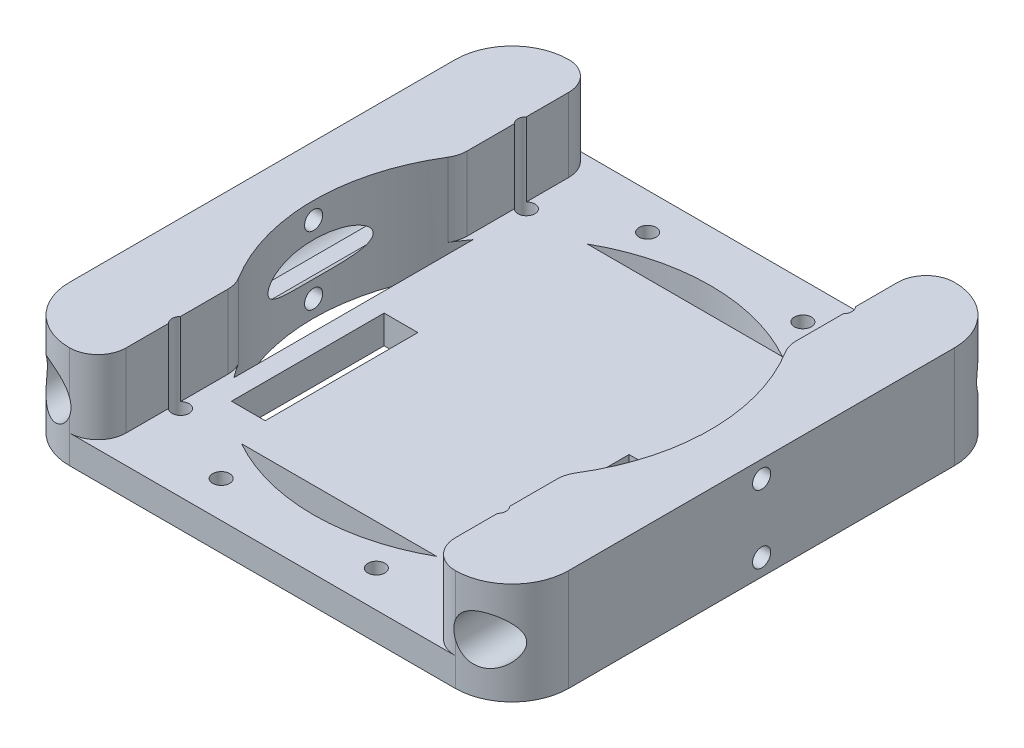
from build123d import *

# Parameters (mm, degrees)
BOSS_EXTRUDE1_DEPTH     = 18
SKETCH2_R               = 4.250000000000005
CUT_EXTRUDE1_DEPTH      = 101.0199980003999
FILLET1_R               = 10
SKETCH3_R               = 35.00000000000001
CUT_EXTRUDE2_DEPTH      = 65.77653912644608
BOSS_EXTRUDE2_START     = 5
SKETCH5_R               = 43.99999999999999
SKETCH5_R_2             = 35.00000000000001
BOSS_EXTRUDE2_DEPTH     = 5
SKETCH8_W               = 58
SKETCH8_H               = 92
CUT_EXTRUDE4_DEPTH      = 13
FILLET2_R               = 5
BOSS_EXTRUDE3_DEPTH     = 5
CUT_EXTRUDE5_DEPTH      = 64.56886046013409
CUT_EXTRUDE5_DEPTH_BACK = 64.56886046013409
SKETCH11_R              = 1.5000000000000009
CUT_EXTRUDE6_REACH      = 102.02
CUT_EXTRUDE6_END_RADIUS = 35.00000000000001
SKETCH12_R              = 1.6000000000000008
SKETCH12_R_2            = 1.6000000000000003
SKETCH13_R              = 1.5000000000000024
CUT_EXTRUDE7_DEPTH      = 64.56886046013409
MIRROR3_COPY_1_SKETCH_R = 1.5000000000000024
MIRROR3_COPY_1_DEPTH    = 64.56886046013409


with BuildPart() as part:
    # Sketch1 → Boss-Extrude1 (new body)
    with BuildSketch(Plane(origin=(0, 0, 0), x_dir=(1, 0, 0), z_dir=(0, 1, 0))):
        Polygon((-44, -44), (43.99999999999999, -44), (43.99999999999999, 44), (-43.99999999999999, 44), align=None)
    extrude(amount=BOSS_EXTRUDE1_DEPTH)

    # Sketch2 → Cut-Extrude1 (cut, through all)
    with BuildSketch(Plane.XY.offset(44)):
        with Locations((-38, 9)):
            Circle(SKETCH2_R)
        with Locations(Location((38, 9, 0), (0, 0, 180))):
            Circle(SKETCH2_R)
    extrude(amount=-CUT_EXTRUDE1_DEPTH, mode=Mode.SUBTRACT)

    # Fillet1
    # the kernel refuses this fillet: 10 mm, written as the material it takes off along each edge
    with BuildSketch(Plane(origin=(44, -25, 44), x_dir=(-1, 0, 0), z_dir=(0, 1, 0)), Plane(origin=(43.99999999999999, -25, -44), x_dir=(0, 0, 1), z_dir=(0, 1, 0))) as fillet1_piece_1:
        with BuildLine():
            CenterArc((FILLET1_R, -FILLET1_R), FILLET1_R, 90, 90)
            Line((0, -FILLET1_R), (0, 0))
            Line((0, 0), (FILLET1_R, 0))
        make_face()
    extrude(amount=68, mode=Mode.SUBTRACT)
    with BuildSketch(Plane(origin=(-44, -25, 44), x_dir=(1, 0, 0), z_dir=(0, 1, 0)), Plane(origin=(-43.99999999999999, -25, -44), x_dir=(0, 0, 1), z_dir=(0, 1, 0))) as fillet1_piece_2:
        with BuildLine():
            CenterArc((FILLET1_R, FILLET1_R), FILLET1_R, 180, 90)
            Line((0, FILLET1_R), (0, 0))
            Line((0, 0), (FILLET1_R, 0))
        make_face()
    extrude(amount=68, mode=Mode.SUBTRACT)

    # Sketch3 → Cut-Extrude2 (cut, through all)
    with BuildSketch(Plane(origin=(0, 18, 0), x_dir=(1, 0, 0), z_dir=(0, 1, 0))):
        with Locations(Location((0, 0, 0), (0, 0, 270))):
            Circle(SKETCH3_R)
    extrude(amount=-CUT_EXTRUDE2_DEPTH, mode=Mode.SUBTRACT)

    # Sketch5 → Boss-Extrude2 (add)
    with BuildSketch(Plane(origin=(0, 0, 0), x_dir=(1, 0, 0), z_dir=(0, 1, 0)).offset(BOSS_EXTRUDE2_START)):
        Circle(SKETCH5_R)
        with Locations(Location((0, 0, 0), (0, 0, 270))):
            Circle(SKETCH5_R_2, mode=Mode.SUBTRACT)
    extrude(amount=-BOSS_EXTRUDE2_DEPTH)

    # Sketch8 → Cut-Extrude4 (cut)
    with BuildSketch(Plane(origin=(0, 18, 0), x_dir=(1, 0, 0), z_dir=(0, 1, 0))):
        Rectangle(SKETCH8_W, SKETCH8_H)
    extrude(amount=-CUT_EXTRUDE4_DEPTH, mode=Mode.SUBTRACT)

    # Fillet2
    # the kernel refuses this fillet: 5 mm, written as the material it takes off along each edge
    with BuildSketch(Plane(origin=(29, 30.5, 44), x_dir=(1, 0, 0), z_dir=(0, -1, 0)), Plane(origin=(-29.000000000000007, 30.5, -44), x_dir=(-1, 0, 0), z_dir=(0, -1, 0))) as fillet2_piece_1:
        with BuildLine():
            CenterArc((FILLET2_R, -FILLET2_R), FILLET2_R, 90, 90)
            Line((0, -FILLET2_R), (0, 0))
            Line((0, 0), (FILLET2_R, 0))
        make_face()
    extrude(amount=25.5, mode=Mode.SUBTRACT)
    with BuildSketch(Plane(origin=(28.999999999999996, 5, 19.59591794226544), x_dir=(0.5434386589178635, 0, -0.8394488811080482), z_dir=(0, 1, 0))) as fillet2_piece_2:
        with BuildLine():
            CenterArc((1.4786791763610776, -4.999028131277516), FILLET2_R, 91.12970087647003, 31.78833061705157)
            Line((-1.2385141182282366, -0.8017837257372739), (0, 0))
            ThreePointArc((0, 0), (0.6900502823018299, -0.00680308105738167), (1.380100564603668, -4e-17))
        make_face()
    extrude(amount=16.688473908600116, mode=Mode.SUBTRACT)
    with BuildSketch(Plane(origin=(28.999999999999996, 5, -19.59591794226544), x_dir=(2.41e-15, 0, -1), z_dir=(0, 1, 0))) as fillet2_piece_3:
        with BuildLine():
            CenterArc((1.475389563440055, -5), FILLET2_R, 90.00000000000014, 31.788330617051614)
            ThreePointArc((-1.15852387477314, -0.7500000000000063), (-0.5755648801402335, -0.38071083878170736), (0, 0))
            Line((0, 0), (1.475389563440043, 0))
        make_face()
    extrude(amount=16.688473908600105, mode=Mode.SUBTRACT)
    with BuildSketch(Plane(origin=(28.999999999999996, 5, -44), x_dir=(1, 0, 0), z_dir=(0, 1, 0))) as fillet2_piece_4:
        with BuildLine():
            CenterArc((FILLET2_R, -FILLET2_R), FILLET2_R, 90, 89.99999999999991)
            Line((-3.55e-15, -FILLET2_R), (0, 0))
            Line((0, 0), (FILLET2_R, 0))
        make_face()
    extrude(amount=25.49999999999999, mode=Mode.SUBTRACT)
    with BuildSketch(Plane(origin=(-29.000000000000004, 5, -19.59591794226543), x_dir=(2.41e-15, 0, -1), z_dir=(0, 1, 0))) as fillet2_piece_5:
        with BuildLine():
            CenterArc((1.4753895634400487, 5), FILLET2_R, 238.21166938294837, 31.78833061705177)
            ThreePointArc((-1.1585238747731363, 0.7500000000000008), (-0.575564880140214, 0.3807108387816939), (0, 0))
            Line((0, 0), (1.4753895634400607, 0))
        make_face()
    extrude(amount=16.68847390860015, mode=Mode.SUBTRACT)
    with BuildSketch(Plane(origin=(-29.000000000000004, 5, 19.59591794226543), x_dir=(-0.5434386589178587, 0, -0.8394488811080513), z_dir=(0, 1, 0))) as fillet2_piece_6:
        with BuildLine():
            CenterArc((1.4786791763610454, 4.9990281312775195), FILLET2_R, 237.08196850647857, 31.78833061705177)
            Line((-1.238514118228257, 0.8017837257372686), (0, 0))
            ThreePointArc((0, 0), (0.6900502823018377, 0.00680308105738472), (1.380100564603667, -2e-17))
        make_face()
    extrude(amount=16.68847390860015, mode=Mode.SUBTRACT)
    with BuildSketch(Plane(origin=(-29.000000000000004, 5, 44), x_dir=(-1, 0, 0), z_dir=(0, 1, 0))) as fillet2_piece_7:
        with BuildLine():
            CenterArc((FILLET2_R, -FILLET2_R), FILLET2_R, 90, 90)
            Line((-3.55e-15, -FILLET2_R), (0, 0))
            Line((0, 0), (FILLET2_R, 0))
        make_face()
    extrude(amount=25.5, mode=Mode.SUBTRACT)

    # Sketch10 → Boss-Extrude3 (add)
    with BuildSketch(Plane(origin=(0, 5, 0), x_dir=(1, 0, 0), z_dir=(0, 1, 0))):
        Polygon((27.94, -30.48), (-27.94, -30.48000000000001), (-27.94, 30.479999999999986), (27.94, 30.479999999999993), align=None)
        Polygon((-19.12, -24.380000000000003), (-24.07, -24.380000000000003), (-24.07, 1.5299999999999967), (-19.12, 1.5299999999999976), align=None, mode=Mode.SUBTRACT)
        Polygon((24.06, -24.379999999999995), (19.11, -24.379999999999995), (19.11, 1.530000000000002), (24.06, 1.5300000000000027), align=None, mode=Mode.SUBTRACT)
    extrude(amount=-BOSS_EXTRUDE3_DEPTH)

    # Sketch11 → Cut-Extrude5 (cut, two sides: drawn at the far end of the back side and taken through both)
    with BuildSketch(Plane(origin=(0, 5, 0), x_dir=(1, 0, 0), z_dir=(0, 1, 0)).offset(-CUT_EXTRUDE5_DEPTH_BACK)):
        with Locations(Location((-27.94, 30.479999999999993, 0), (0, 0, 270))):
            Circle(SKETCH11_R)
        with Locations(Location((27.940000000000005, 30.479999999999993, 0), (0, 0, 270))):
            Circle(SKETCH11_R)
        with Locations(Location((-27.94, -30.479999999999993, 0), (0, 0, 270))):
            Circle(SKETCH11_R)
        with Locations(Location((27.940000000000005, -30.479999999999993, 0), (0, 0, 270))):
            Circle(SKETCH11_R)
        Polygon((18.609999999999996, 2.029999999999996), (18.61, -24.880000000000003), (24.560000000000002, -24.880000000000003), (24.56, 2.0299999999999967), align=None)
        Polygon((-24.569999999999997, -24.880000000000003), (-18.62, -24.880000000000003), (-18.620000000000005, 2.0299999999999967), (-24.57, 2.0299999999999967), align=None)
    extrude(amount=CUT_EXTRUDE5_DEPTH + CUT_EXTRUDE5_DEPTH_BACK, mode=Mode.SUBTRACT)

    # Cut-Extrude6: up to this cylinder (the profile starts outside it)
    cut_extrude6_end = Plane(origin=(0, 9, 0), z_dir=(0, 1, 0)) * Cylinder(CUT_EXTRUDE6_END_RADIUS, 287.04, mode=Mode.PRIVATE)
    # Sketch12 → Cut-Extrude6 (cut, up to the surface)
    with BuildSketch(Plane(origin=(43.99999999999999, 0, 0), x_dir=(0, 0, -1), z_dir=(1, 0, 0)), mode=Mode.PRIVATE) as cut_extrude6_sk1:
        with Locations((0, 15)):
            Circle(SKETCH12_R)
    cut_extrude6_tool1 = extrude(cut_extrude6_sk1.sketch, amount=-CUT_EXTRUDE6_REACH, mode=Mode.PRIVATE) - cut_extrude6_end
    # Sketch12 → Cut-Extrude6 (cut, up to the surface)
    with BuildSketch(Plane(origin=(43.99999999999999, 0, 0), x_dir=(0, 0, -1), z_dir=(1, 0, 0)), mode=Mode.PRIVATE) as cut_extrude6_sk2:
        with Locations((0, 3.000000000000001)):
            Circle(SKETCH12_R_2)
    cut_extrude6_tool2 = extrude(cut_extrude6_sk2.sketch, amount=-CUT_EXTRUDE6_REACH, mode=Mode.PRIVATE) - cut_extrude6_end
    cut_extrude6 = cut_extrude6_tool1.solids().sort_by_distance((44, 15, 0))[0] + cut_extrude6_tool2.solids().sort_by_distance((44, 3, 0))[0]
    add(cut_extrude6, mode=Mode.SUBTRACT)

    # Mirror1: Cut-Extrude6 across plane
    add(cut_extrude6.mirror(Plane(origin=(0, 0, 0), x_dir=(0, 0, 1), z_dir=(1, 0, 0))), mode=Mode.SUBTRACT)

    # Sketch13 → Cut-Extrude7 (cut, symmetric)
    with BuildSketch(Plane(origin=(0, 5, 0), x_dir=(1, 0, 0), z_dir=(0, 1, 0))):
        with Locations(Location((-13.680805733026524, 37.58770483143641, 0), (0, 0, 270))):
            Circle(SKETCH13_R)
    cut_extrude7 = extrude(amount=CUT_EXTRUDE7_DEPTH, both=True, mode=Mode.SUBTRACT)

    # Mirror2: Cut-Extrude7 across plane
    add(cut_extrude7.mirror(Plane(origin=(0, 0, 0), x_dir=(0, 0, 1), z_dir=(1, 0, 0))), mode=Mode.SUBTRACT)

    # Mirror3: Cut-Extrude7 across plane
    add(cut_extrude7.mirror(Plane.XY), mode=Mode.SUBTRACT)

    # Mirror3 copy 1 sketch → Mirror3 copy 1 (cut, symmetric)
    with BuildSketch(Plane(origin=(0, 5, 0), x_dir=(-1, 0, 0), z_dir=(0, 1, 0))):
        with Locations(Location((-13.680805733026524, 37.58770483143641, 0), (0, 0, 270))):
            Circle(MIRROR3_COPY_1_SKETCH_R)
    extrude(amount=MIRROR3_COPY_1_DEPTH, both=True, mode=Mode.SUBTRACT)


solid = part.part
